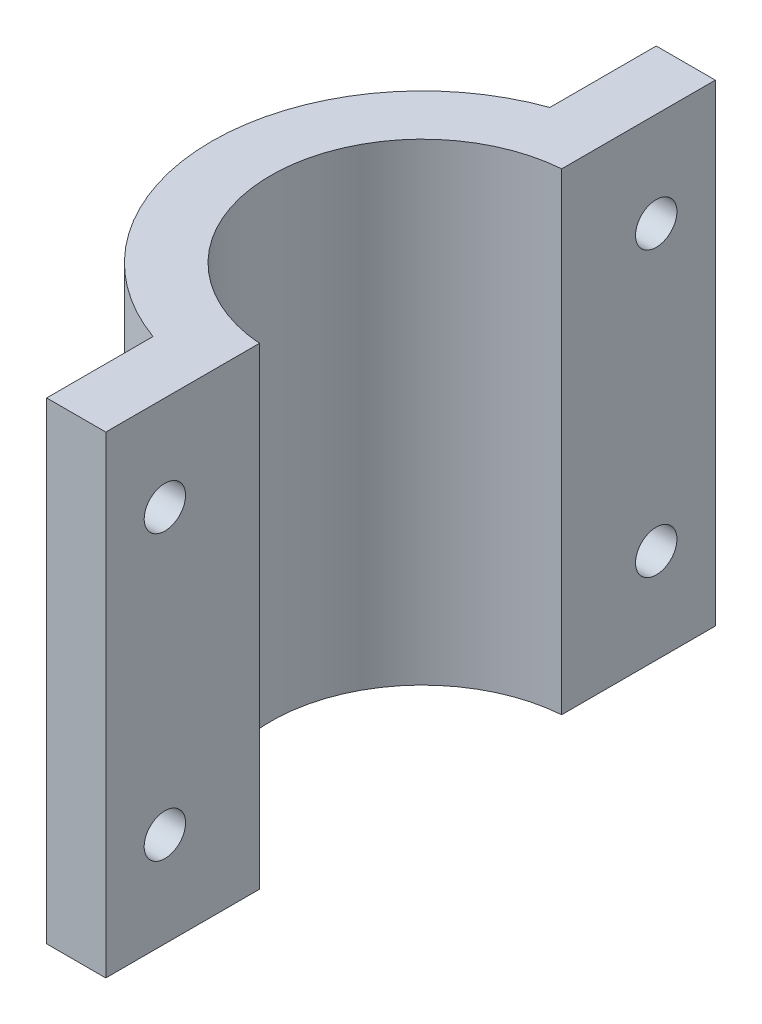
from build123d import *

# Parameters (mm, degrees)
BOSS_EXTRUDE4_DEPTH = 40
SKETCH7_R           = 1.75
CUT_EXTRUDE1_DEPTH  = 51.47710617


with BuildPart() as part:
    # Sketch6 → Boss-Extrude4 (new body)
    with BuildSketch(Plane.XZ):
        with BuildLine():
            Line((-1, 25.784833184), (-1, 12.785954208))
            ThreePointArc((-1, 12.785954208), (-12.825, 0), (-1, -12.785954208))
            Line((-1, -12.785954208), (-1, -25.784833184))
            Line((-1, -25.784833184), (-6, -25.784833184))
            Line((-6, -25.784833184), (-6, -16.784833184))
            ThreePointArc((-6, -16.784833184), (-17.825, 0), (-6, 16.784833184))
            Line((-6, 16.784833184), (-6, 25.784833184))
            Line((-6, 25.784833184), (-1, 25.784833184))
        make_face()
    extrude(amount=BOSS_EXTRUDE4_DEPTH)

    # Sketch7 → Cut-Extrude1 (cut, through all)
    with BuildSketch(Plane(origin=(-1, 0, 0), x_dir=(0, 0, -1), z_dir=(1, 0, 0))):
        with Locations((-20.784833184, -8)):
            Circle(SKETCH7_R)
        with Locations((20.784833184, -8)):
            Circle(SKETCH7_R)
        with Locations((20.784833184, -32)):
            Circle(SKETCH7_R)
        with Locations((-20.784833184, -32)):
            Circle(SKETCH7_R)
    extrude(amount=-CUT_EXTRUDE1_DEPTH, mode=Mode.SUBTRACT)


solid = part.part
